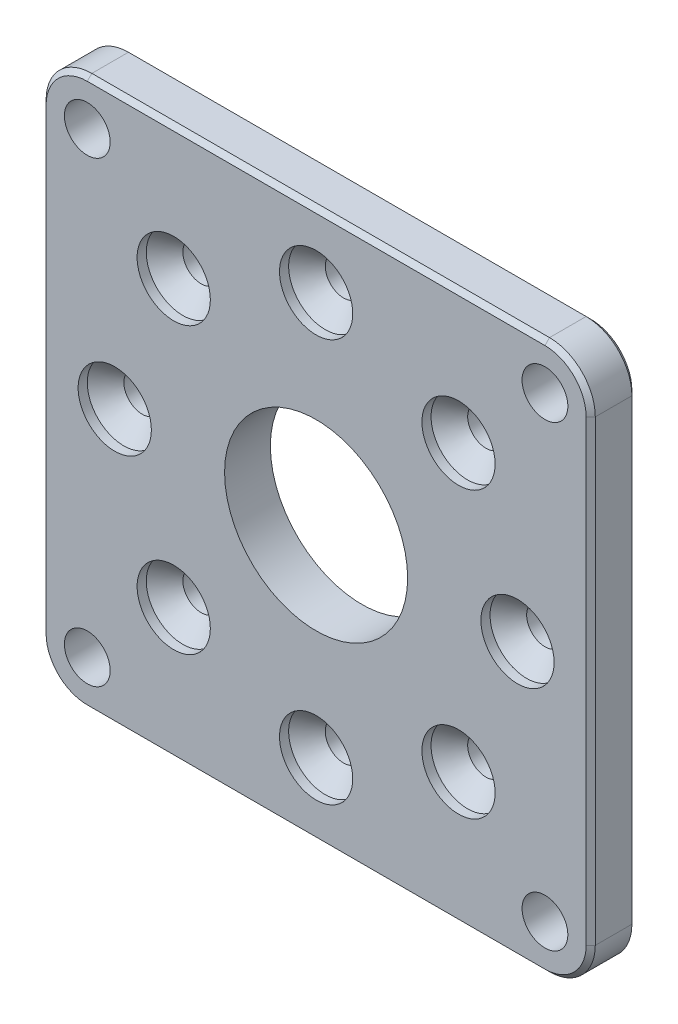
from build123d import *

# Parameters (mm, degrees)
SKETCH_1_R          = 2.5
SKETCH_1_R_2        = 10
SKETCH_1_R_3        = 2
EXTRUDE_1_DEPTH     = 5
SKETCH_2_R          = 4
CUT_EXTRUDE_1_DEPTH = 1
CHAMFER_1_SIZE      = 2
CHAMFER1_SIZE       = 0.5


with BuildPart() as part:
    # 草图1 → 凸台-拉伸1 (new body)
    with BuildSketch(Plane.XY):
        with BuildLine():
            Line((-25, -30), (25, -30))
            ThreePointArc((25, -30), (28.535533906, -28.535533906), (30, -25))
            Line((30, -25), (30, 25))
            ThreePointArc((30, 25), (28.535533906, 28.535533906), (25, 30))
            Line((25, 30), (-25, 30))
            ThreePointArc((-25, 30), (-28.535533906, 28.535533906), (-30, 25))
            Line((-30, 25), (-30, -25))
            ThreePointArc((-30, -25), (-28.535533906, -28.535533906), (-25, -30))
        make_face()
        with Locations((-25, 25)):
            Circle(SKETCH_1_R, mode=Mode.SUBTRACT)
        with Locations(Location((-25, -25, 0), (0, 0, 180))):
            Circle(SKETCH_1_R, mode=Mode.SUBTRACT)
        with Locations((25, -25)):
            Circle(SKETCH_1_R, mode=Mode.SUBTRACT)
        with Locations(Location((25, 25, 0), (0, 0, 180))):
            Circle(SKETCH_1_R, mode=Mode.SUBTRACT)
        Circle(SKETCH_1_R_2, mode=Mode.SUBTRACT)
        with Locations((-15.556349186, 15.556349186)):
            Circle(SKETCH_1_R_3, mode=Mode.SUBTRACT)
        with Locations((0, 22)):
            Circle(SKETCH_1_R_3, mode=Mode.SUBTRACT)
        with Locations((15.556349186, 15.556349186)):
            Circle(SKETCH_1_R_3, mode=Mode.SUBTRACT)
        with Locations((22, 0)):
            Circle(SKETCH_1_R_3, mode=Mode.SUBTRACT)
        with Locations((15.556349186, -15.556349186)):
            Circle(SKETCH_1_R_3, mode=Mode.SUBTRACT)
        with Locations((0, -22)):
            Circle(SKETCH_1_R_3, mode=Mode.SUBTRACT)
        with Locations((-15.556349186, -15.556349186)):
            Circle(SKETCH_1_R_3, mode=Mode.SUBTRACT)
        with Locations((-22, 0)):
            Circle(SKETCH_1_R_3, mode=Mode.SUBTRACT)
    extrude(amount=EXTRUDE_1_DEPTH)

    # 草图2 → 切除-拉伸1 (cut)
    with BuildSketch(Plane.XY.offset(5)):
        with Locations((-15.556349186, 15.556349186)):
            Circle(SKETCH_2_R)
        with Locations((0, 22)):
            Circle(SKETCH_2_R)
        with Locations((15.556349186, 15.556349186)):
            Circle(SKETCH_2_R)
        with Locations((22, 0)):
            Circle(SKETCH_2_R)
        with Locations((15.556349186, -15.556349186)):
            Circle(SKETCH_2_R)
        with Locations((0, -22)):
            Circle(SKETCH_2_R)
        with Locations((-15.556349186, -15.556349186)):
            Circle(SKETCH_2_R)
        with Locations((-22, 0)):
            Circle(SKETCH_2_R)
    extrude(amount=-CUT_EXTRUDE_1_DEPTH, mode=Mode.SUBTRACT)

    # 倒角1
    chamfer_1_edges = [part.edges().sort_by_distance(p)[0] for p in [
        (13.556349186, -15.556349186, 4),
        (20, 0, 4),
        (13.556349186, 15.556349186, 4),
        (-2, 22, 4),
        (-17.556349186, 15.556349186, 4),
        (-24, 0, 4),
        (-17.556349186, -15.556349186, 4),
        (-2, -22, 4),
    ]]
    chamfer(chamfer_1_edges, length=CHAMFER_1_SIZE - 0.0001)  # a hair under: the kernel refuses the full size

    # Chamfer1
    chamfer1_edges = [part.edges().sort_by_distance(p)[0] for p in [
        (-30, 0, 0),
        (-28.535533906, 28.535533906, 0),
        (0, 30, 0),
        (28.535533906, 28.535533906, 0),
        (-28.535533906, 28.535533906, 5),
        (-30, 0, 5),
        (-28.535533906, -28.535533906, 5),
        (0, -30, 5),
        (28.535533906, -28.535533906, 5),
        (30, 0, 5),
        (28.535533906, 28.535533906, 5),
        (30, 0, 0),
        (0, 30, 5),
        (28.535533906, -28.535533906, 0),
        (0, -30, 0),
        (-28.535533906, -28.535533906, 0),
    ]]
    chamfer(chamfer1_edges, length=CHAMFER1_SIZE)


solid = part.part
